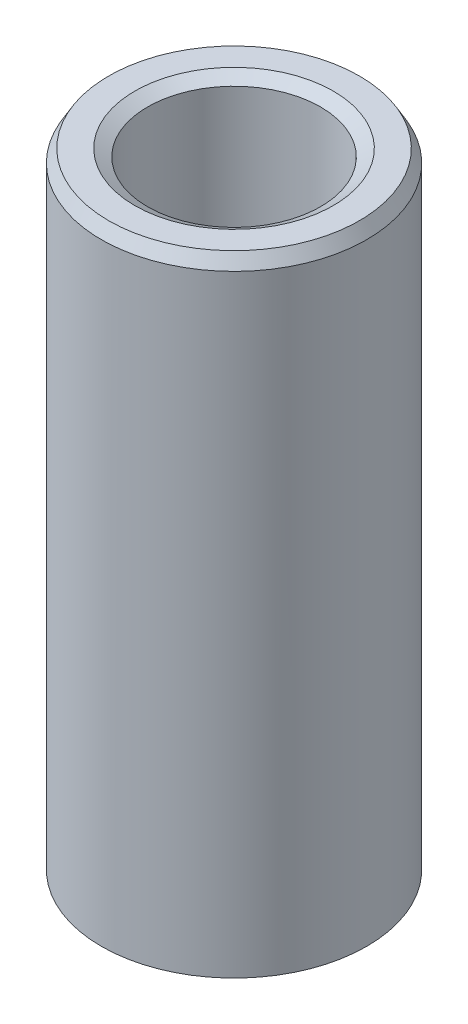
from build123d import *
from OCP.BRepFilletAPI import BRepFilletAPI_MakeChamfer

# Parameters (mm, degrees)
SKETCH1_R           = 15
BOSS_EXTRUDE1_DEPTH = 71.439483784
SKETCH2_R           = 9.775546913
CUT_EXTRUDE1_DEPTH  = 75.522478779
CHAMFER1_SIZE       = 1.43954304
CHAMFER1_SIZE2      = 0.831120562


with BuildPart() as part:
    # Sketch1 → Boss-Extrude1 (new body)
    with BuildSketch(Plane(origin=(0, 0, 0), x_dir=(1, 0, 0), z_dir=(0, 1, 0))):
        Circle(SKETCH1_R)
    extrude(amount=BOSS_EXTRUDE1_DEPTH)

    # Sketch2 → Cut-Extrude1 (cut, through all)
    with BuildSketch(Plane(origin=(0, 0, 0), x_dir=(1, 0, 0), z_dir=(0, 1, 0))):
        Circle(SKETCH2_R)
    extrude(amount=CUT_EXTRUDE1_DEPTH, mode=Mode.SUBTRACT)

    # Chamfer1: one chamfer whose edges measure the first distance from different faces: ONE call of the kernel's chamfer builder (chamfer() names one face for all edges)
    chamfer1_edges_1 = [part.edges().sort_by_distance(p)[0] for p in [
        (-9.775546913, 71.439483784, 0),
    ]]
    chamfer1_side_1 = [part.faces().sort_by_distance(p)[0] for p in [
        (-14.575735931, 71.439483784, 0),
    ]]
    chamfer1_edges_2 = [part.edges().sort_by_distance(p)[0] for p in [
        (-9.775546913, 0, 0),
    ]]
    chamfer1_side_2 = [part.faces().sort_by_distance(p)[0] for p in [
        (-9.775546913, 35.719741892, 0),
    ]]
    chamfer1_edges_3 = [part.edges().sort_by_distance(p)[0] for p in [
        (-15, 0, 0),
    ]]
    chamfer1_side_3 = [part.faces().sort_by_distance(p)[0] for p in [
        (-14.575735931, 0, 0),
    ]]
    chamfer1_edges_4 = [part.edges().sort_by_distance(p)[0] for p in [
        (-15, 71.439483784, 0),
    ]]
    chamfer1_side_4 = [part.faces().sort_by_distance(p)[0] for p in [
        (-15, 35.719741892, 0),
    ]]
    chamfer1 = BRepFilletAPI_MakeChamfer(part.part.solid().wrapped)
    for e in chamfer1_edges_1:
        chamfer1.Add(CHAMFER1_SIZE, CHAMFER1_SIZE2, e.wrapped, chamfer1_side_1[0].wrapped)  # the first distance lies on this face
    for e in chamfer1_edges_2:
        chamfer1.Add(CHAMFER1_SIZE, CHAMFER1_SIZE2, e.wrapped, chamfer1_side_2[0].wrapped)  # the first distance lies on this face
    for e in chamfer1_edges_3:
        chamfer1.Add(CHAMFER1_SIZE, CHAMFER1_SIZE2, e.wrapped, chamfer1_side_3[0].wrapped)  # the first distance lies on this face
    for e in chamfer1_edges_4:
        chamfer1.Add(CHAMFER1_SIZE, CHAMFER1_SIZE2, e.wrapped, chamfer1_side_4[0].wrapped)  # the first distance lies on this face
    add(Compound.cast(chamfer1.Shape()), mode=Mode.REPLACE)


solid = part.part
